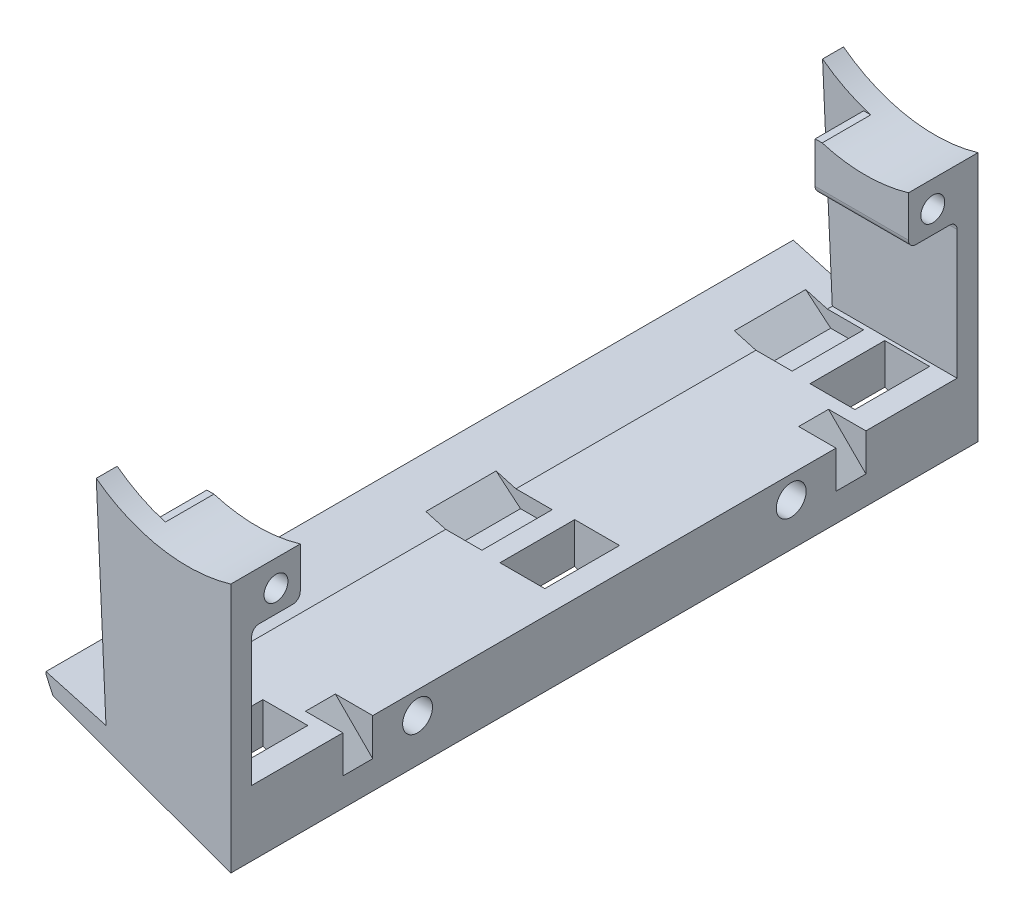
from build123d import *

# Parameters (mm, degrees)
RESSALTO_EXTRUS_O1_DEPTH = 100
CORTE_EXTRUS_O1_DEPTH    = 100
ESBO_O4_W                = 6
ESBO_O4_H                = 10
CORTE_EXTRUS_O3_DEPTH    = 100
ESBO_O6_W                = 4.394129168
ESBO_O6_H                = 9.553687289
ESBO_O6_W_2              = 4.232922622
ESBO_O6_H_2              = 9.401185036
ESBO_O6_H_3              = 9.804760869
CORTE_EXTRUS_O4_DEPTH    = 2
CORTE_EXTRUS_O5_DEPTH    = 9.804760869
CORTE_EXTRUS_O6_DEPTH    = 9.401185036
CORTE_EXTRUS_O7_DEPTH    = 9.553687289
RESSALTO_EXTRUS_O2_DEPTH = 2.8
RESSALTO_EXTRUS_O3_DEPTH = 2.8
CHANFRO1_SIZE            = 1
CHANFRO1_SIZE2           = 1.673157185
ESBO_O12_R               = 2
CORTE_EXTRUS_O8_DEPTH    = 5
ESBO_O14_W               = 6.5
ESBO_O14_H               = 6.5
RESSALTO_EXTRUS_O4_DEPTH = 12.5
CORTE_EXTRUS_O9_DEPTH    = 100
ESBO_O17_R               = 1.6
CORTE_EXTRUS_O10_DEPTH   = 100
FILETE1_R                = 1
ESBO_O18_W               = 5
ESBO_O18_H               = 4
CORTE_EXTRUS_O11_DEPTH   = 5
CHANFRO2_SIZE            = 5


with BuildPart() as part:
    # Esboço1 → Ressalto-extrusão1 (new body)
    with BuildSketch(Plane.XY):
        Polygon((51, -6.786066874), (51, -20.786066874), (26.272703225, -11.786066874), (26.272703225, -6.786066874), align=None)
    extrude(amount=-RESSALTO_EXTRUS_O1_DEPTH)

    # Esboço2 → Corte-extrusão1 (cut)
    with BuildSketch(Plane.XY):
        Polygon((34.3, -12.026146103), (26.272703225, -9.786066874), (26.272703225, -6.786066874), (51, -6.786066874), (51, -12.026146103), (49.5, -12.026146103), align=None)
    extrude(amount=-CORTE_EXTRUS_O1_DEPTH, mode=Mode.SUBTRACT)

    # Esboço4 → Corte-extrusão3 (cut)
    with BuildSketch(Plane(origin=(0, -12.026146103, 0), x_dir=(1, 0, 0), z_dir=(0, 1, 0))):
        with Locations((44.8, 91.726127663)):
            Rectangle(ESBO_O4_W, ESBO_O4_H)
        with Locations((44.8, 50.226127663)):
            Rectangle(ESBO_O4_W, ESBO_O4_H)
        with Locations((44.8, 8.5)):
            Rectangle(ESBO_O4_W, ESBO_O4_H)
    extrude(amount=-CORTE_EXTRUS_O3_DEPTH, mode=Mode.SUBTRACT)

    # Esboço6 → Corte-extrusão4 (cut)
    with BuildSketch(Plane(origin=(0, -12.026146103, 0), x_dir=(1, 0, 0), z_dir=(0, 1, 0))):
        with Locations((36.946648007, 91.760642218)):
            Rectangle(ESBO_O6_W, ESBO_O6_H)
        with Locations((37.02725128, 50.165247763)):
            Rectangle(ESBO_O6_W_2, ESBO_O6_H_2)
        with Locations((37.02725128, 8.595463062)):
            Rectangle(ESBO_O6_W_2, ESBO_O6_H_3)
    extrude(amount=-CORTE_EXTRUS_O4_DEPTH, mode=Mode.SUBTRACT)

    # Esboço7 → Corte-extrusão5 (cut)
    with BuildSketch(Plane.XY.offset(-13.497843496)):
        Polygon((34.910789969, -12.026146103), (34.910789969, -14.026146103), (31.643973079, -11.284961255), align=None)
    extrude(amount=CORTE_EXTRUS_O5_DEPTH, mode=Mode.SUBTRACT)

    # Esboço8 → Corte-extrusão6 (cut)
    with BuildSketch(Plane.XY.offset(-54.865840281)):
        Polygon((34.910789969, -14.026146103), (34.910789969, -12.026146103), (31.335529191, -11.026146103), align=None)
    extrude(amount=CORTE_EXTRUS_O6_DEPTH, mode=Mode.SUBTRACT)

    # Esboço9 → Corte-extrusão7 (cut)
    with BuildSketch(Plane.XY.offset(-96.537485862)):
        Polygon((34.749583423, -14.026146103), (34.749583423, -12.026146103), (30.165579372, -10.179709995), align=None)
    extrude(amount=CORTE_EXTRUS_O7_DEPTH, mode=Mode.SUBTRACT)

    # Esboço10 → Ressalto-extrusão2 (add)
    with BuildSketch(Plane.XY):
        Polygon((51, -12.026146103), (51, 9.973853897), (51, 12.713933126), (49.541118417, 12.747281328), (45.801947659, 12.747281328), (33, 15.973853897), (34.3, -12.026146103), align=None)
    extrude(amount=-RESSALTO_EXTRUS_O2_DEPTH)

    # Esboço11 → Ressalto-extrusão3 (add)
    with BuildSketch(Plane(origin=(0, 0, -100), x_dir=(-1, 0, 0), z_dir=(0, 0, -1))):
        Polygon((-34.3, -12.026146103), (-33, 15.973853897), (-45.271603303, 12.747281328), (-49.541118417, 12.747281328), (-51, 12.713933126), (-51, -12.026146103), align=None)
    extrude(amount=-RESSALTO_EXTRUS_O3_DEPTH)

    # Chanfro1
    chanfro1_edges = [part.edges().sort_by_distance(p)[0] for p in [
        (26.272703225, -11.786066874, -50),
    ]]
    chanfro1_side = [part.faces().sort_by_distance(p)[0] for p in [
        (38.152449511, -16.109940913, -49.988164623),
    ]]
    chamfer(chanfro1_edges, length=CHANFRO1_SIZE, length2=CHANFRO1_SIZE2, reference=chanfro1_side[0])

    # Esboço12 → Corte-extrusão8 (cut)
    with BuildSketch(Plane(origin=(51, 0, 0), x_dir=(0, 0, -1), z_dir=(1, 0, 0))):
        with Locations((75, -15.026146103)):
            Circle(ESBO_O12_R)
        with Locations((25, -15.026146103)):
            Circle(ESBO_O12_R)
    extrude(amount=-CORTE_EXTRUS_O8_DEPTH, mode=Mode.SUBTRACT)

    # Esboço14 → Ressalto-extrusão4 (add)
    with BuildSketch(Plane(origin=(51, 0, 0), x_dir=(0, 0, -1), z_dir=(1, 0, 0))):
        with Locations((6.05, 9.463933126)):
            Rectangle(ESBO_O14_W, ESBO_O14_H)
        with Locations((93.95, 9.463933126)):
            Rectangle(ESBO_O14_W, ESBO_O14_H)
    extrude(amount=-RESSALTO_EXTRUS_O4_DEPTH)

    # Esboço15 → Corte-extrusão9 (cut)
    with BuildSketch(Plane.XY):
        with BuildLine():
            ThreePointArc((33, 15.973853897), (41.611155482, 12.19684706), (51, 12.713933126))
            ThreePointArc((51, 12.713933126), (42.289458716, 15.942170666), (33, 15.973853897))
        make_face()
    extrude(amount=-CORTE_EXTRUS_O9_DEPTH, mode=Mode.SUBTRACT)

    # Esboço17 → Corte-extrusão10 (cut)
    with BuildSketch(Plane.ZY.offset(-38.5)):
        with Locations((-6.05, 9.213933126)):
            Circle(ESBO_O17_R)
        with Locations((-93.95, 9.213933126)):
            Circle(ESBO_O17_R)
    extrude(amount=-CORTE_EXTRUS_O10_DEPTH, mode=Mode.SUBTRACT)

    # Filete1
    filete1_edges = [part.edges().sort_by_distance(p)[0] for p in [
        (44.75, 6.213933126, -2.8),
        (44.75, 6.213933126, -9.3),
        (44.75, 6.213933126, -97.2),
        (44.75, 6.213933126, -90.7),
    ]]
    fillet(filete1_edges, radius=FILETE1_R)

    # Esboço18 → Corte-extrusão11 (cut)
    with BuildSketch(Plane(origin=(0, -12.026146103, 0), x_dir=(1, 0, 0), z_dir=(0, 1, 0))):
        with Locations((48.5, 17)):
            Rectangle(ESBO_O18_W, ESBO_O18_H)
        with Locations((48.5, 83)):
            Rectangle(ESBO_O18_W, ESBO_O18_H)
    extrude(amount=-CORTE_EXTRUS_O11_DEPTH, mode=Mode.SUBTRACT)

    # Chanfro2
    chanfro2_edges = [part.edges().sort_by_distance(p)[0] for p in [
        (46, -17.026146103, -83),
        (46, -17.026146103, -17),
    ]]
    chamfer(chanfro2_edges, length=CHANFRO2_SIZE - 0.0001)  # a hair under: the kernel refuses the full size


solid = part.part
